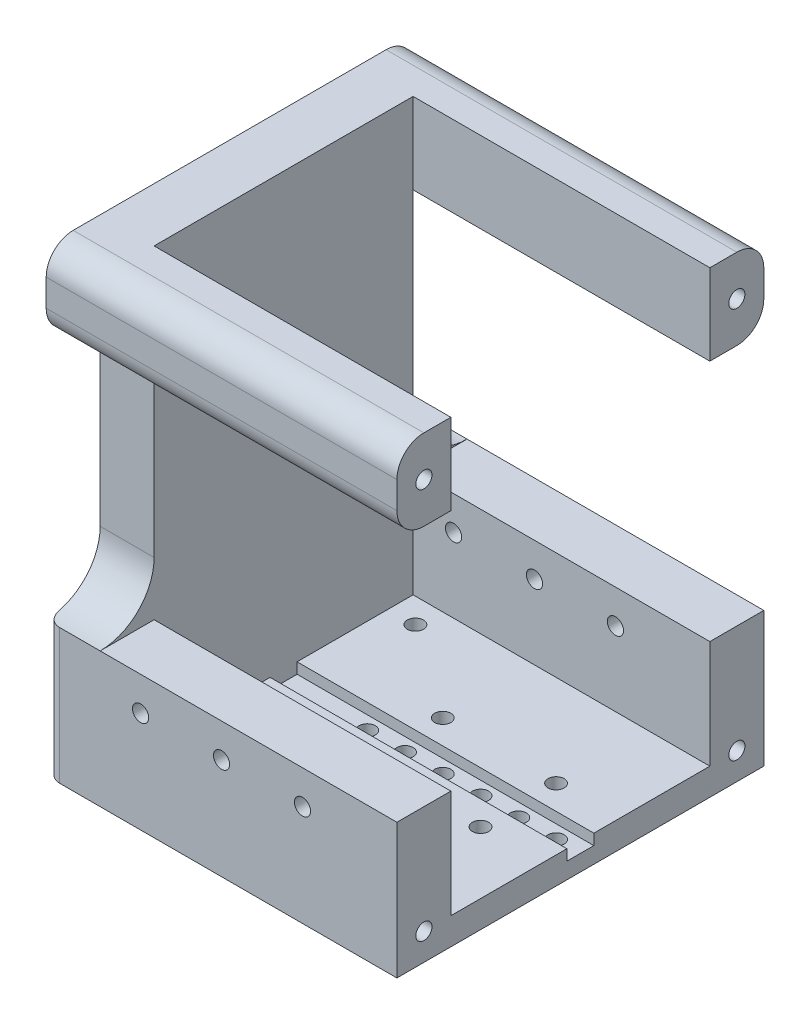
from build123d import *

# Parameters (mm, degrees)
SKETCH_2_W                 = 48
SKETCH_2_H                 = 75
EXTRUDE_1_DEPTH            = 10
EXTRUDE_2_DEPTH            = 55
EXTRUDE_2_DEPTH_BACK       = 10
SKETCH_5_W                 = 10
SKETCH_5_H                 = 10
EXTRUDE_2_2_DEPTH          = 55
EXTRUDE_2_2_DEPTH_BACK     = 10
SKETCH_5_H_2               = 20
EXTRUDE_2_3_DEPTH          = 55
EXTRUDE_2_3_DEPTH_BACK     = 10
EXTRUDE_2_4_DEPTH          = 55
EXTRUDE_2_4_DEPTH_BACK     = 10
EXTRUDE_3_DEPTH            = 5
SKETCH_7_R                 = 2.5
CUT_EXTRUDE_1_DEPTH        = 10
FILLET_1_R                 = 10
SKETCH_8_R                 = 1.5
CUT_EXTRUDE_2_DEPTH        = 121.205647632
PATTERN_LINEAR_1_COUNT     = 2
PATTERN_LINEAR_1_PITCH     = 15
PATTERN_LINEAR_1_COL_COUNT = 2
PATTERN_LINEAR_1_COL_PITCH = 15
SKETCH_10_R                = 1.5
CUT_EXTRUDE_4_DEPTH        = 10
SKETCH_11_R                = 1.5
CUT_EXTRUDE_5_DEPTH        = 5
FILLET_9_R                 = 2.5
EXTRUDE_5_DEPTH            = 5
FILLET_10_R                = 5
FILLET_11_R                = 5
SKETCH_14_R                = 1.5
CUT_EXTRUDE_6_DEPTH        = 5
SKETCH_15_W                = 5
SKETCH_15_H                = 2
CUT_EXTRUDE_7_DEPTH        = 55
SKETCH_17_R                = 1.5
CUT_EXTRUDE_10_DEPTH       = 118.336631714


with BuildPart() as part:
    # 草图2 → 凸台-拉伸1 (new body)
    with BuildSketch(Plane(origin=(0, 0, 0), x_dir=(0, 0, -1), z_dir=(1, 0, 0))):
        with Locations((22.061440678, -32.335805085)):
            Rectangle(SKETCH_2_W, SKETCH_2_H)
    extrude(amount=EXTRUDE_1_DEPTH)



with BuildPart() as body_2:
    # 草图5 → 凸台-拉伸2 (new, two sides: drawn at the far end of the back side and taken through both)
    with BuildSketch(Plane(origin=(10, 0, 0), x_dir=(0, 0, -1), z_dir=(1, 0, 0)).offset(-EXTRUDE_2_DEPTH_BACK)):
        with Locations((51.061440678, 0.164194915)):
            Rectangle(SKETCH_5_W, SKETCH_5_H)
    extrude(amount=EXTRUDE_2_DEPTH + EXTRUDE_2_DEPTH_BACK)


with BuildPart() as body_3:
    # 草图5 → Extrude 2 2 (new, two sides: drawn at the far end of the back side and taken through both)
    with BuildSketch(Plane(origin=(10, 0, 0), x_dir=(0, 0, -1), z_dir=(1, 0, 0)).offset(-EXTRUDE_2_2_DEPTH_BACK)):
        with Locations((51.061440678, -59.835805085)):
            Rectangle(SKETCH_5_W, SKETCH_5_H_2)
    extrude(amount=EXTRUDE_2_2_DEPTH + EXTRUDE_2_2_DEPTH_BACK)


with BuildPart() as body_4:
    # 草图5 → Extrude 2 3 (new, two sides: drawn at the far end of the back side and taken through both)
    with BuildSketch(Plane(origin=(10, 0, 0), x_dir=(0, 0, -1), z_dir=(1, 0, 0)).offset(-EXTRUDE_2_3_DEPTH_BACK)):
        with Locations((-6.938559322, -59.835805085)):
            Rectangle(SKETCH_5_W, SKETCH_5_H_2)
    extrude(amount=EXTRUDE_2_3_DEPTH + EXTRUDE_2_3_DEPTH_BACK)


with BuildPart() as body_5:
    # 草图5 → Extrude 2 4 (new, two sides: drawn at the far end of the back side and taken through both)
    with BuildSketch(Plane(origin=(10, 0, 0), x_dir=(0, 0, -1), z_dir=(1, 0, 0)).offset(-EXTRUDE_2_4_DEPTH_BACK)):
        with Locations((-6.938559322, 0.164194915)):
            Rectangle(SKETCH_5_W, SKETCH_5_H)
    extrude(amount=EXTRUDE_2_4_DEPTH + EXTRUDE_2_4_DEPTH_BACK)


with BuildPart() as part_1:
    add(part.part)

    add(body_3.part)  # 凸台-拉伸3 merges body 3

    add(body_4.part)  # 凸台-拉伸3 merges body 4
    # 草图6 → 凸台-拉伸3 (add)
    with BuildSketch(Plane.XZ.offset(69.835805085)):
        Polygon((65, 1.938559322), (65, 11.938559322), (0, 11.938559322), (0, 1.938559322), (0, -46.061440678), (0, -56.061440678), (65, -56.061440678), (65, -46.061440678), align=None)
    extrude(amount=EXTRUDE_3_DEPTH)

    # 草图7 → 切除-拉伸1 (cut)
    with BuildSketch(Plane.ZY):
        with Locations((-22.061440678, -22.335805085)):
            Circle(SKETCH_7_R)
    extrude(amount=-CUT_EXTRUDE_1_DEPTH, mode=Mode.SUBTRACT)

    # 圆角1
    fillet_1_edges = [part_1.edges().sort_by_distance(p)[0] for p in [
        (5, -49.835805085, -46.061440678),
        (5, -49.835805085, 1.938559322),
    ]]
    fillet(fillet_1_edges, radius=FILLET_1_R - 0.0001)  # a hair under: the kernel refuses the full size

    # 草图8 → 切除-拉伸2 (cut, through all)
    with BuildSketch(Plane(origin=(0, 0, -56.061440678), x_dir=(-1, 0, 0), z_dir=(0, 0, -1))):
        with Locations((-32.5, -56.085805085)):
            Circle(SKETCH_8_R)
    cut_extrude_2 = extrude(amount=-CUT_EXTRUDE_2_DEPTH, mode=Mode.SUBTRACT)

    # 阵列(线性)1: 切除-拉伸2 ×2
    with Locations(*[(i * PATTERN_LINEAR_1_PITCH, 0, 0) for i in range(1, PATTERN_LINEAR_1_COUNT)]):
        add(cut_extrude_2, mode=Mode.SUBTRACT)

    # 阵列(线性)1 col: 切除-拉伸2 ×2
    with Locations(*[(-i * PATTERN_LINEAR_1_COL_PITCH, 0, 0) for i in range(1, PATTERN_LINEAR_1_COL_COUNT)]):
        add(cut_extrude_2, mode=Mode.SUBTRACT)

    # 草图10 → 切除-拉伸4 (cut)
    with BuildSketch(Plane(origin=(0, -69.835805085, 0), x_dir=(1, 0, 0), z_dir=(0, 1, 0))):
        with Locations(Location((15, 2.632869249, 0), (0, 0, 270))):
            Circle(SKETCH_10_R)
        with Locations(Location((15, 41.490012107, 0), (0, 0, 270))):
            Circle(SKETCH_10_R)
    extrude(amount=-CUT_EXTRUDE_4_DEPTH, mode=Mode.SUBTRACT)

    # 草图11 → 切除-拉伸5 (cut)
    with BuildSketch(Plane(origin=(65, 0, 0), x_dir=(0, 0, -1), z_dir=(1, 0, 0))):
        with Locations((51.061440678, -69.835805085)):
            Circle(SKETCH_11_R)
        with Locations((-6.938559322, -69.835805085)):
            Circle(SKETCH_11_R)
    extrude(amount=-CUT_EXTRUDE_5_DEPTH, mode=Mode.SUBTRACT)

    # 圆角9
    fillet_9_edges = [part_1.edges().sort_by_distance(p)[0] for p in [
        (0, -62.335805085, -56.061440678),
        (0, -62.335805085, 11.938559322),
    ]]
    fillet(fillet_9_edges, radius=FILLET_9_R)


    add(body_2.part)  # 凸台-拉伸5 merges body 2

    add(body_5.part)  # 凸台-拉伸5 merges body 5
    # 草图13 → 凸台-拉伸5 (add)
    with BuildSketch(Plane(origin=(0, 5.164194915, 0), x_dir=(1, 0, 0), z_dir=(0, 1, 0))):
        Polygon((0, -11.938559322), (65, -11.938559322), (65, -1.938559322), (10, -1.938559322), (10, 46.061440678), (65, 46.061440678), (65, 56.061440678), (0, 56.061440678), (0, 46.061440678), (0, -1.938559322), align=None)
    extrude(amount=EXTRUDE_5_DEPTH)

    # 圆角10
    fillet_10_edges = [part_1.edges().sort_by_distance(p)[0] for p in [
        (32.5, 10.164194915, 11.938559322),
        (32.5, -4.835805085, 11.938559322),
    ]]
    fillet(fillet_10_edges, radius=FILLET_10_R)

    # 圆角11
    fillet_11_edges = [part_1.edges().sort_by_distance(p)[0] for p in [
        (32.5, 10.164194915, -56.061440678),
        (32.5, -4.835805085, -56.061440678),
    ]]
    fillet(fillet_11_edges, radius=FILLET_11_R)

    # 草图14 → 切除-拉伸6 (cut)
    with BuildSketch(Plane(origin=(65, 0, 0), x_dir=(0, 0, -1), z_dir=(1, 0, 0))):
        with Locations((-6.938559322, 2.664194915)):
            Circle(SKETCH_14_R)
        with Locations((51.061440678, 2.664194915)):
            Circle(SKETCH_14_R)
    extrude(amount=-CUT_EXTRUDE_6_DEPTH, mode=Mode.SUBTRACT)

    # 草图15 → 切除-拉伸7 (cut)
    with BuildSketch(Plane(origin=(65, 0, 0), x_dir=(0, 0, -1), z_dir=(1, 0, 0))):
        with Locations((22.061440678, -70.835805085)):
            Rectangle(SKETCH_15_W, SKETCH_15_H)
    extrude(amount=-CUT_EXTRUDE_7_DEPTH, mode=Mode.SUBTRACT)

    # 草图17 → 切除-拉伸10 (cut, through all)
    with BuildSketch(Plane(origin=(0, -69.835805085, 0), x_dir=(1, 0, 0), z_dir=(0, 1, 0))):
        with Locations(Location((60.5, 22.061440678, 0), (0, 0, 270))):
            Circle(SKETCH_17_R)
        with Locations(Location((46.5, 22.061440678, 0), (0, 0, 270))):
            Circle(SKETCH_17_R)
        with Locations(Location((53.5, 29.061440678, 0), (0, 0, 270))):
            Circle(SKETCH_17_R)
        with Locations(Location((53.5, 22.061440678, 0), (0, 0, 270))):
            Circle(SKETCH_17_R)
        with Locations(Location((53.5, 15.061440678, 0), (0, 0, 270))):
            Circle(SKETCH_17_R)
        with Locations(Location((32.5, 15.061440678, 0), (0, 0, 270))):
            Circle(SKETCH_17_R)
        with Locations(Location((39.5, 22.061440678, 0), (0, 0, 270))):
            Circle(SKETCH_17_R)
        with Locations(Location((25.5, 22.061440678, 0), (0, 0, 270))):
            Circle(SKETCH_17_R)
        with Locations(Location((32.5, 22.061440678, 0), (0, 0, 270))):
            Circle(SKETCH_17_R)
        with Locations(Location((32.5, 29.061440678, 0), (0, 0, 270))):
            Circle(SKETCH_17_R)
    extrude(amount=-CUT_EXTRUDE_10_DEPTH, mode=Mode.SUBTRACT)


solid = part_1.part
